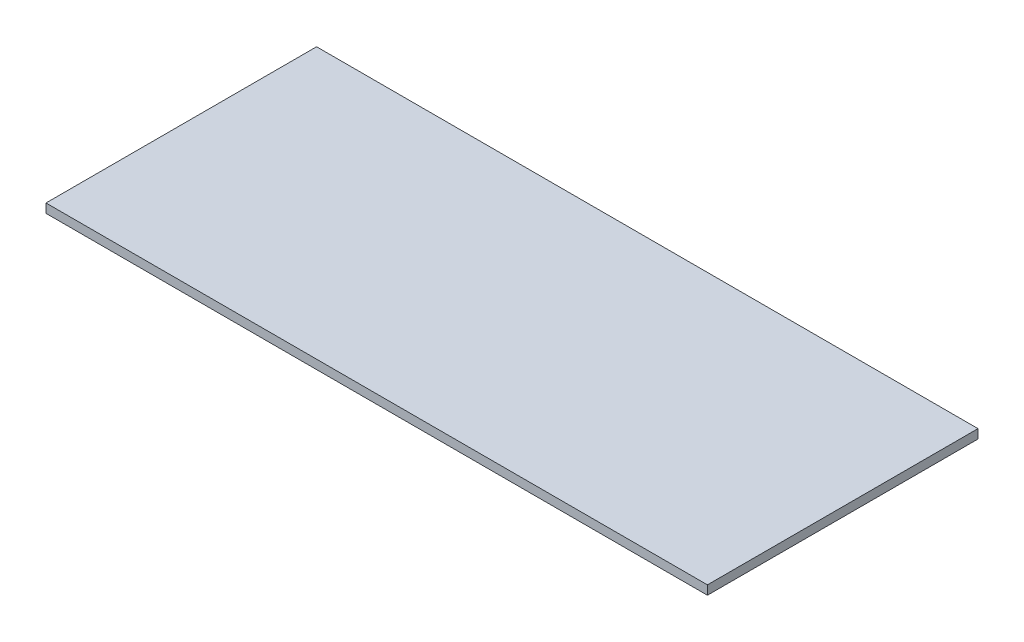
from build123d import *

# Parameters (mm, degrees)
SKETCH2_W           = 220
SKETCH2_H           = 90
BOSS_EXTRUDE1_DEPTH = 3


with BuildPart() as part:
    # Sketch2 → Boss-Extrude1 (new body)
    with BuildSketch(Plane(origin=(0, 0, 0), x_dir=(1, 0, 0), z_dir=(0, 1, 0))):
        Rectangle(SKETCH2_W, SKETCH2_H)
    extrude(amount=BOSS_EXTRUDE1_DEPTH)


solid = part.part
